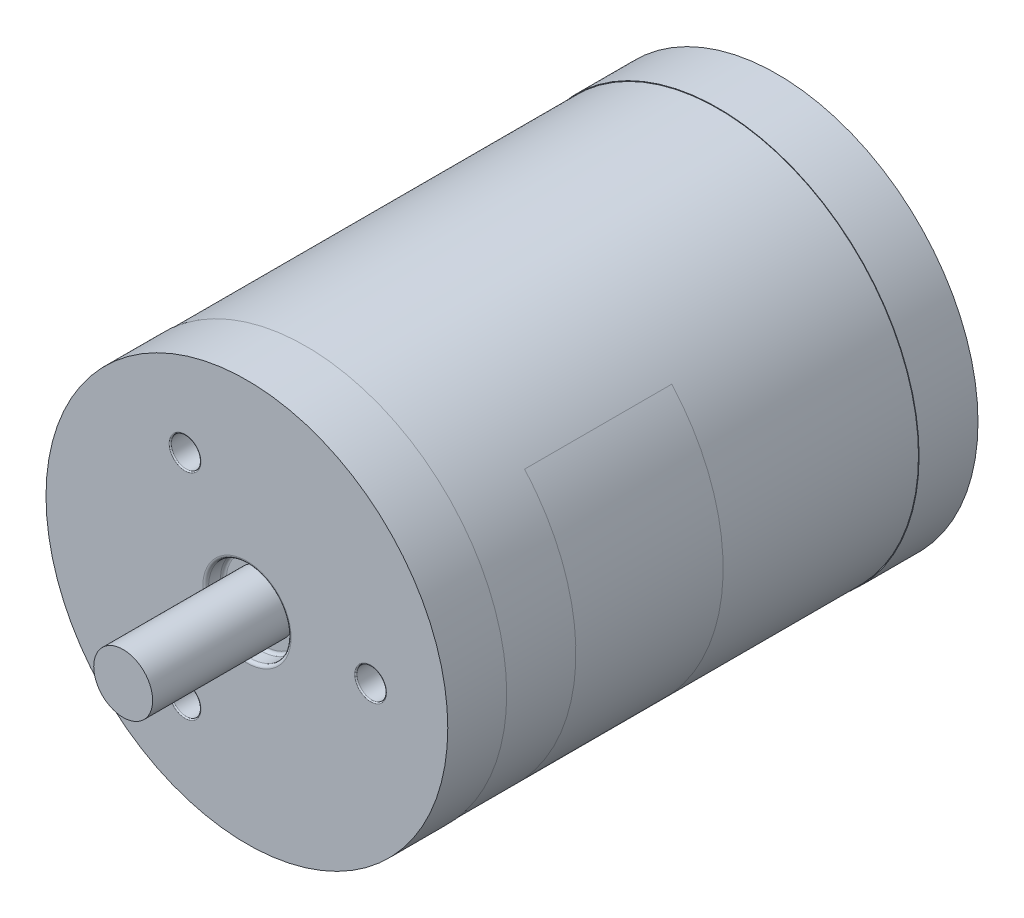
from build123d import *

# Parameters (mm, degrees)
CROQUIS1_R                 = 34
SALIENTE_EXTRUIR1_DEPTH    = 45
CROQUIS2_R                 = 5
SALIENTE_EXTRUIR2_DEPTH    = 21
CROQUIS3_R                 = 2.5
CORTAR_EXTRUIR1_DEPTH      = 5
CROQUIS4_R                 = 15
SALIENTE_EXTRUIR3_DEPTH    = 10.5
CROQUIS5_R                 = 2
CORTAR_EXTRUIR2_DEPTH      = 10.5
CROQUIS6_R                 = 34.1
CROQUIS6_R_2               = 2.5
SALIENTE_EXTRUIR4_DEPTH    = 10
REDONDEO1_R                = 1
CORTAR_EXTRUIR3_DEPTH      = 5
CORTAR_EXTRUIR3_DEPTH_BACK = 5
CROQUIS8_W                 = 18.660748896
CROQUIS8_H                 = 10.045403252
CROQUIS9_R                 = 2
CORTAR_EXTRUIR4_DEPTH      = 5
CORTAR_EXTRUIR5_START      = -3
CROQUIS10_R                = 7
CROQUIS10_R_2              = 5
CORTAR_EXTRUIR5_DEPTH      = 3
REDONDEO2_R                = 0.5
REDONDEO3_R                = 0.5
REDONDEO4_R                = 0.2


with BuildPart() as part:
    # Croquis1 → Saliente-Extruir1 (new, symmetric)
    with BuildSketch(Plane.XY):
        Circle(CROQUIS1_R)
    extrude(amount=SALIENTE_EXTRUIR1_DEPTH, both=True)

    # Croquis2 → Saliente-Extruir2 (add)
    with BuildSketch(Plane.XY.offset(45)):
        Circle(CROQUIS2_R)
    extrude(amount=SALIENTE_EXTRUIR2_DEPTH)

    # Croquis3 → Cortar-Extruir1 (cut)
    with BuildSketch(Plane.XY.offset(45)):
        with Locations((21, 0)):
            Circle(CROQUIS3_R)
        with Locations((-10.5, -18.186533479)):
            Circle(CROQUIS3_R)
        with Locations((-10.5, 18.186533479)):
            Circle(CROQUIS3_R)
    extrude(amount=-CORTAR_EXTRUIR1_DEPTH, mode=Mode.SUBTRACT)

    # Croquis4 → Saliente-Extruir3 (add)
    with BuildSketch(Plane(origin=(0, 0, -45), x_dir=(-1, 0, 0), z_dir=(0, 0, -1))):
        Circle(CROQUIS4_R)
    extrude(amount=SALIENTE_EXTRUIR3_DEPTH)

    # Croquis5 → Cortar-Extruir2 (cut)
    with BuildSketch(Plane(origin=(0, 0, -45), x_dir=(-1, 0, 0), z_dir=(0, 0, -1))):
        with Locations((-30, 0)):
            Circle(CROQUIS5_R)
        with Locations((30, 0)):
            Circle(CROQUIS5_R)
    extrude(amount=-CORTAR_EXTRUIR2_DEPTH, mode=Mode.SUBTRACT)

    # Croquis6 → Saliente-Extruir4 (add)
    with BuildSketch(Plane.XY.offset(45)):
        Circle(CROQUIS6_R)
        with Locations((21, 0)):
            Circle(CROQUIS6_R_2, mode=Mode.SUBTRACT)
        with Locations((-10.5, -18.186533479)):
            Circle(CROQUIS6_R_2, mode=Mode.SUBTRACT)
        with Locations((-10.5, 18.186533479)):
            Circle(CROQUIS6_R_2, mode=Mode.SUBTRACT)
    saliente_extruir4 = extrude(amount=-SALIENTE_EXTRUIR4_DEPTH)

    # Simetría1: Saliente-Extruir4 across plane
    add(saliente_extruir4.mirror(Plane.XY))

    # Redondeo1
    redondeo1_edges = [part.edges().sort_by_distance(p)[0] for p in [
        (15, 0, -55.5),
    ]]
    fillet(redondeo1_edges, radius=REDONDEO1_R)

    # Croquis8 → Cortar-Extruir3 (cut, two sides: drawn at the far end of the back side and taken through both)
    with BuildSketch(Plane(origin=(0, -34, 0), x_dir=(-1, 0, 0), z_dir=(0, -1, 0)).offset(-CORTAR_EXTRUIR3_DEPTH_BACK)):
        with Locations((0, -38.527445352)):
            Rectangle(CROQUIS8_W, CROQUIS8_H)
    extrude(amount=CORTAR_EXTRUIR3_DEPTH + CORTAR_EXTRUIR3_DEPTH_BACK, mode=Mode.SUBTRACT)

    # Croquis9 → Cortar-Extruir4 (cut)
    with BuildSketch(Plane(origin=(0, 0, -45), x_dir=(-1, 0, 0), z_dir=(0, 0, -1))):
        with Locations((30, 0)):
            Circle(CROQUIS9_R)
        with Locations((-30, 0)):
            Circle(CROQUIS9_R)
    extrude(amount=-CORTAR_EXTRUIR4_DEPTH, mode=Mode.SUBTRACT)

    # Croquis10 → Cortar-Extruir5 (cut)
    with BuildSketch(Plane.XY.offset(45).offset(CORTAR_EXTRUIR5_START)):
        Circle(CROQUIS10_R)
        Circle(CROQUIS10_R_2, mode=Mode.SUBTRACT)
    extrude(amount=CORTAR_EXTRUIR5_DEPTH, mode=Mode.SUBTRACT)

    # Redondeo2
    redondeo2_edges = [part.edges().sort_by_distance(p)[0] for p in [
        (-7, 0, 45),
    ]]
    fillet(redondeo2_edges, radius=REDONDEO2_R)

    # Redondeo3
    redondeo3_edges = [part.edges().sort_by_distance(p)[0] for p in [
        (-7, 0, 42),
    ]]
    fillet(redondeo3_edges, radius=REDONDEO3_R)

    # Redondeo4
    redondeo4_edges = [part.edges().sort_by_distance(p)[0] for p in [
        (-13, 18.186533479, 45),
        (18.5, 0, 45),
        (-13, -18.186533479, 45),
    ]]
    fillet(redondeo4_edges, radius=REDONDEO4_R)


solid = part.part
